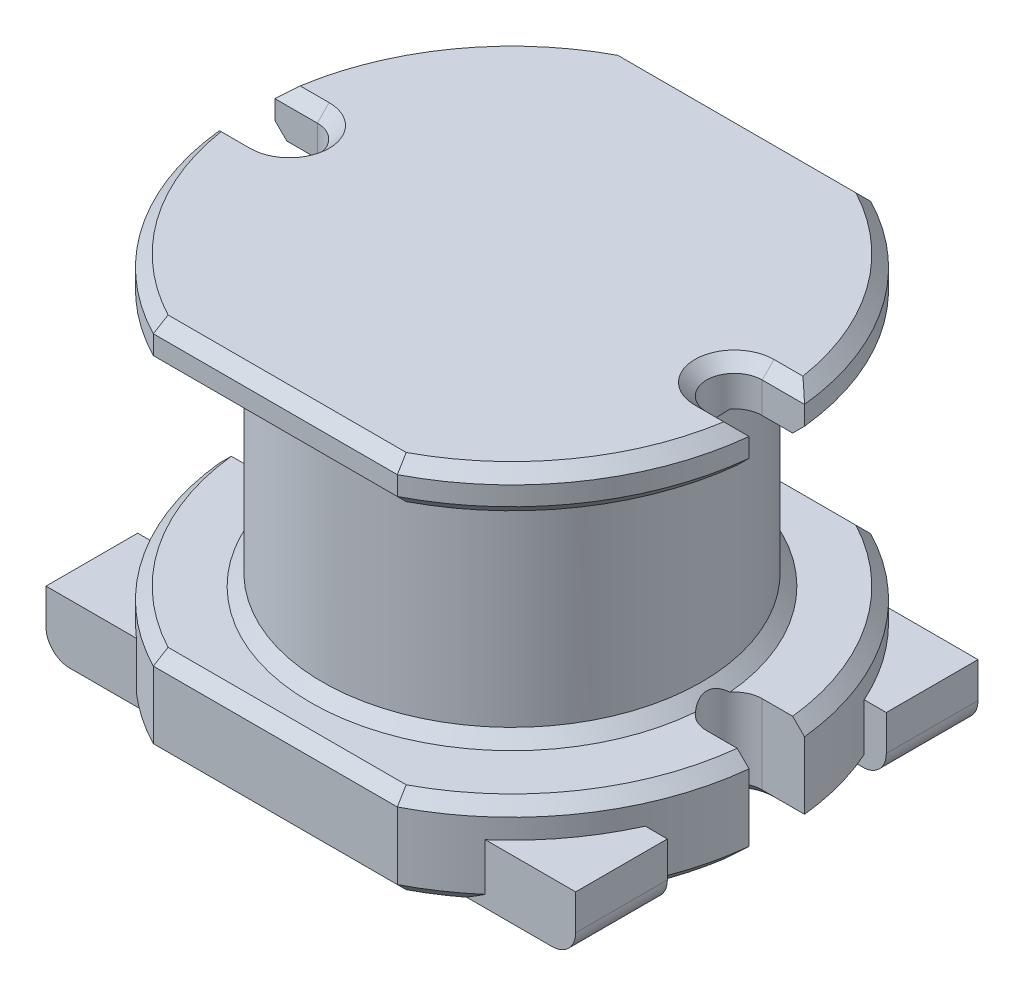
from build123d import *

# Parameters (mm, degrees)
SKETCH_2_W          = 6.934811306
SKETCH_2_H          = 5.876958734
SKETCH_2_W_2        = 4.5
SKETCH_2_H_2        = 4
CUT_EXTRUDE_1_DEPTH = 5.512759688
CUT_EXTRUDE_2_DEPTH = 5.39346105
CHAMFER_1_SIZE      = 0.1
EXTRUDE_1_DEPTH     = 0.5
FILLET_1_R          = 0.2


with BuildPart() as part:
    # Эскиз1 → Повернуть1 (revolve)
    with BuildSketch(Plane.XY, mode=Mode.PRIVATE) as revolve_1_sk:
        Polygon((0, 0), (2.25, 0), (2.25, 0.767770183), (1.602303081, 0.767770183), (1.602303081, 2.84), (2.25, 2.84), (2.25, 3.2), (0, 3.2), align=None)
    revolve(revolve_1_sk.sketch.rotate(Axis((0, 3.2, 0), (0, -1, 0)), 180), axis=Axis((0, 3.2, 0), (0, -1, 0)))

    # Эскиз2 → Вырез-Вытянуть1 (cut, through all)
    with BuildSketch(Plane(origin=(0, 3.2, 0), x_dir=(1, 0, 0), z_dir=(0, 1, 0))):
        Rectangle(SKETCH_2_W, SKETCH_2_H)
        Rectangle(SKETCH_2_W_2, SKETCH_2_H_2, mode=Mode.SUBTRACT)
    extrude(amount=-CUT_EXTRUDE_1_DEPTH, mode=Mode.SUBTRACT)

    # Эскиз3 → Вырез-Вытянуть2 (cut, through all)
    with BuildSketch(Plane(origin=(0, 3.2, 0), x_dir=(1, 0, 0), z_dir=(0, 1, 0))):
        with BuildLine():
            Line((-2.620412251, 0.234387219), (-1.879587749, 0.234387219))
            ThreePointArc((-1.879587749, 0.234387219), (-1.64520053, 0), (-1.879587749, -0.234387219))
            Line((-1.879587749, -0.234387219), (-2.620412251, -0.234387219))
            ThreePointArc((-2.620412251, -0.234387219), (-2.85479947, 0), (-2.620412251, 0.234387219))
        make_face()
        with BuildLine():
            Line((2.620412251, 0.234387219), (1.879587749, 0.234387219))
            ThreePointArc((1.879587749, 0.234387219), (1.64520053, 0), (1.879587749, -0.234387219))
            Line((1.879587749, -0.234387219), (2.620412251, -0.234387219))
            ThreePointArc((2.620412251, -0.234387219), (2.85479947, 0), (2.620412251, 0.234387219))
        make_face()
    extrude(amount=-CUT_EXTRUDE_2_DEPTH, mode=Mode.SUBTRACT)

    # Фаска1
    # the kernel refuses this chamfer: 0.1 mm, written as the material it adds along each edge
    with BuildSketch(Plane(origin=(0, 2.84, 0), x_dir=(-1, 0, 0), z_dir=(0, 0, 1))) as chamfer_1_piece_1_section:
        Polygon((1.602303081, CHAMFER_1_SIZE), (1.602303081 + CHAMFER_1_SIZE, 0), (1.602303081, 0), align=None)
    chamfer_1_piece_1 = revolve(axis=Axis((0, 2.84, 0), (0, -1, 0)), mode=Mode.PRIVATE)
    chamfer_1_piece_1 = chamfer_1_piece_1 - Plane(origin=(1.879587749, 2.757485291, 0), x_dir=(0, 0, -1), z_dir=(0, 1, 0)) * Cylinder(0.234387219, 7, mode=Mode.PRIVATE)
    chamfer_1_piece_1 = chamfer_1_piece_1 - Plane(origin=(-1.879587749, 2.757485291, 0), x_dir=(0, 0, -1), z_dir=(0, 1, 0)) * Cylinder(0.234387219, 7, mode=Mode.PRIVATE)
    add(chamfer_1_piece_1)
    with BuildSketch(Plane(origin=(0, 0.767770183, 0), x_dir=(-1, 0, 0), z_dir=(0, 0, 1))) as chamfer_1_piece_2_section:
        Polygon((1.602303081 + CHAMFER_1_SIZE, 0), (1.602303081, -CHAMFER_1_SIZE), (1.602303081, 0), align=None)
    chamfer_1_piece_2 = revolve(axis=Axis((0, 0.767770183, 0), (0, -1, 0)), mode=Mode.PRIVATE)
    chamfer_1_piece_2 = chamfer_1_piece_2 - Plane(origin=(1.879587749, 0.779846989, 0), x_dir=(0, 0, -1), z_dir=(0, 1, 0)) * Cylinder(0.234387219, 7, mode=Mode.PRIVATE)
    chamfer_1_piece_2 = chamfer_1_piece_2 - Plane(origin=(-1.879587749, 0.779846989, 0), x_dir=(0, 0, -1), z_dir=(0, 1, 0)) * Cylinder(0.234387219, 7, mode=Mode.PRIVATE)
    add(chamfer_1_piece_2)
    # the kernel refuses this chamfer: 0.1 mm, written as the material it takes off along each edge
    with BuildSketch(Plane(origin=(1.879587749, 3.2, 0), x_dir=(0, 0, -1), z_dir=(1, 0, 0))) as chamfer_1_2_piece_1:
        Polygon((0.234387219, -CHAMFER_1_SIZE), (0.234387219 + CHAMFER_1_SIZE, 0), (0.234387219, 0), align=None)
    revolve(axis=Axis((1.879587749, 3.2, 0), (0, 1, 0)), revolution_arc=180, mode=Mode.SUBTRACT)
    with BuildSketch(Plane(origin=(1.879587749, 3.2, 0.234387219), x_dir=(0, -0.9996219169112968, -0.027495876610586226), z_dir=(1, 0, 0)), Plane(origin=(1.879587749, 0, 0.234387219), x_dir=(0, -0.027495876610586088, 0.9996219169112966), z_dir=(1, 0, 0)), Plane(origin=(2.494926693, 0, -0.234387219), x_dir=(0, -0.02749587661058639, -0.9996219169112968), z_dir=(-1, 0, 0)), Plane(origin=(2.494926693, 3.2, -0.234387219), x_dir=(0, -0.9996219169112968, 0.027495876610586226), z_dir=(-1, 0, 0))) as chamfer_1_2_piece_2:
        Polygon((CHAMFER_1_SIZE * 0.999621916911, -CHAMFER_1_SIZE * 0.0274958766106), (-CHAMFER_1_SIZE * 0.0274958766106, -CHAMFER_1_SIZE * 0.999621916911), (0, 0), align=None)
    extrude(amount=0.615338944, mode=Mode.SUBTRACT)
    with BuildSketch(Plane(origin=(1.879587749, 0, 0), x_dir=(0, 0, -1), z_dir=(1, 0, 0))) as chamfer_1_2_piece_3:
        Polygon((0.234387219 + CHAMFER_1_SIZE, 0), (0.234387219, CHAMFER_1_SIZE), (0.234387219, 0), align=None)
    revolve(axis=Axis((1.879587749, 0, 0), (0, 1, 0)), revolution_arc=180, mode=Mode.SUBTRACT)
    with BuildSketch(Plane(origin=(0, 3.2, 0), x_dir=(0.9999504609043639, 0, -0.009953679578444508), z_dir=(-0.009953679578444508, 0, -0.9999504609043639))) as chamfer_1_2_piece_4:
        Polygon((2.25, CHAMFER_1_SIZE), (2.25 - CHAMFER_1_SIZE, 0), (2.25, 0), align=None)
    revolve(axis=Axis((0, 3.2, 0), (0, -1, 0)), revolution_arc=69.854051699, mode=Mode.SUBTRACT)
    with BuildSketch(Plane(origin=(1.287944705, 3.2, -2), x_dir=(0, -0.9996219169112966, -0.027495876610587302), z_dir=(-1, 0, 0)), Plane(origin=(-1.287944705, 3.2, 2), x_dir=(0, -0.9996219169112966, 0.027495876610587302), z_dir=(1, 0, 0)), Plane(origin=(1.287944705, 0, -2), x_dir=(0, -0.027495876610586313, 0.9996219169112966), z_dir=(-1, 0, 0)), Plane(origin=(-1.287944705, 0, 2), x_dir=(0, -0.027495876610586324, -0.9996219169112966), z_dir=(1, 0, 0)), Plane(origin=(-1.287944705, 2.84, 2), x_dir=(0, -0.027495876610587302, -0.9996219169112966), z_dir=(1, 0, 0)), Plane(origin=(1.287944705, 2.84, -2), x_dir=(0, -0.027495876610587302, 0.9996219169112966), z_dir=(-1, 0, 0))) as chamfer_1_2_piece_5:
        Polygon((CHAMFER_1_SIZE * 0.999621916911, CHAMFER_1_SIZE * 0.0274958766106), (-CHAMFER_1_SIZE * 0.0274958766106, CHAMFER_1_SIZE * 0.999621916911), (0, 0), align=None)
    extrude(amount=2.57588941, mode=Mode.SUBTRACT)
    with BuildSketch(Plane(origin=(0, 2.84, 0), x_dir=(0.9999504609043639, 0, -0.00995367957844411), z_dir=(-0.00995367957844411, 0, -0.9999504609043639))) as chamfer_1_2_piece_6:
        Polygon((2.25 - CHAMFER_1_SIZE, 0), (2.25, -CHAMFER_1_SIZE), (2.25, 0), align=None)
    revolve(axis=Axis((0, 2.84, 0), (0, -1, 0)), revolution_arc=69.854051699, mode=Mode.SUBTRACT)
    with BuildSketch(Plane(origin=(0, 0.767770183, 0), x_dir=(0.9999504609043639, 0, -0.009953679578444063), z_dir=(-0.009953679578444063, 0, -0.9999504609043639))) as chamfer_1_2_piece_7:
        Polygon((2.25, CHAMFER_1_SIZE), (2.25 - CHAMFER_1_SIZE, 0), (2.25, 0), align=None)
    revolve(axis=Axis((0, 0.767770183, 0), (0, -1, 0)), revolution_arc=69.854051699, mode=Mode.SUBTRACT)
    with BuildSketch(Plane(origin=(0, 0, 0), x_dir=(0.9999504609043639, 0, -0.009953679578444063), z_dir=(-0.009953679578444063, 0, -0.9999504609043639))) as chamfer_1_2_piece_8:
        Polygon((2.25 - CHAMFER_1_SIZE, 0), (2.25, -CHAMFER_1_SIZE), (2.25, 0), align=None)
    revolve(axis=Axis((0, 0, 0), (0, -1, 0)), revolution_arc=69.854051699, mode=Mode.SUBTRACT)
    with BuildSketch(Plane(origin=(1.287944705, 0.767770183, 2), x_dir=(0, -0.9996219169112966, 0.02749587661058733), z_dir=(-1, 0, 0)), Plane(origin=(-1.287944705, 0.767770183, -2), x_dir=(0, -0.9996219169112966, -0.02749587661058733), z_dir=(1, 0, 0))) as chamfer_1_2_piece_9:
        Polygon((CHAMFER_1_SIZE * 0.999621916911, -CHAMFER_1_SIZE * 0.0274958766106), (-CHAMFER_1_SIZE * 0.0274958766106, -CHAMFER_1_SIZE * 0.999621916911), (0, 0), align=None)
    extrude(amount=2.57588941, mode=Mode.SUBTRACT)
    with BuildSketch(Plane(origin=(0, 3.2, 0), x_dir=(-0.9999504609043639, 0, 0.009953679578444261), z_dir=(0.009953679578444261, 0, 0.9999504609043639))) as chamfer_1_2_piece_10:
        Polygon((2.25, CHAMFER_1_SIZE), (2.25 - CHAMFER_1_SIZE, 0), (2.25, 0), align=None)
    revolve(axis=Axis((0, 3.2, 0), (0, -1, 0)), revolution_arc=69.854051699, mode=Mode.SUBTRACT)
    with BuildSketch(Plane(origin=(0, 2.84, 0), x_dir=(-0.9999504609043639, 0, 0.009953679578444063), z_dir=(0.009953679578444063, 0, 0.9999504609043639))) as chamfer_1_2_piece_11:
        Polygon((2.25 - CHAMFER_1_SIZE, 0), (2.25, -CHAMFER_1_SIZE), (2.25, 0), align=None)
    revolve(axis=Axis((0, 2.84, 0), (0, -1, 0)), revolution_arc=69.854051699, mode=Mode.SUBTRACT)
    with BuildSketch(Plane(origin=(0, 3.2, 0), x_dir=(0.3537403249974644, 0, -0.9353436707813274), z_dir=(-0.9353436707813274, 0, -0.3537403249974644))) as chamfer_1_2_piece_12:
        Polygon((2.25, CHAMFER_1_SIZE), (2.25 - CHAMFER_1_SIZE, 0), (2.25, 0), align=None)
    revolve(axis=Axis((0, 3.2, 0), (0, -1, 0)), revolution_arc=69.854051699, mode=Mode.SUBTRACT)
    with BuildSketch(Plane(origin=(0, 3.2, 0), x_dir=(-0.35374032499740626, 0, 0.9353436707813495), z_dir=(0.9353436707813495, 0, 0.35374032499740626))) as chamfer_1_2_piece_13:
        Polygon((2.25, CHAMFER_1_SIZE), (2.25 - CHAMFER_1_SIZE, 0), (2.25, 0), align=None)
    revolve(axis=Axis((0, 3.2, 0), (0, -1, 0)), revolution_arc=69.854051699, mode=Mode.SUBTRACT)
    with BuildSketch(Plane(origin=(-1.879587749, 3.2, 0.234387219), x_dir=(0, -0.9996219169112968, -0.027495876610586226), z_dir=(-1, 0, 0)), Plane(origin=(-2.494926693, 3.2, -0.234387219), x_dir=(0, -0.9996219169112968, 0.027495876610586226), z_dir=(1, 0, 0)), Plane(origin=(-2.494926693, 0, -0.234387219), x_dir=(0, -0.027495876610586407, -0.9996219169112968), z_dir=(1, 0, 0)), Plane(origin=(-1.879587749, 0, 0.234387219), x_dir=(0, -0.027495876610586653, 0.9996219169112966), z_dir=(-1, 0, 0))) as chamfer_1_2_piece_14:
        Polygon((CHAMFER_1_SIZE * 0.999621916911, CHAMFER_1_SIZE * 0.0274958766106), (-CHAMFER_1_SIZE * 0.0274958766106, CHAMFER_1_SIZE * 0.999621916911), (0, 0), align=None)
    extrude(amount=0.615338944, mode=Mode.SUBTRACT)
    with BuildSketch(Plane(origin=(0, 2.84, 0), x_dir=(-0.35374032499745983, 0, 0.9353436707813292), z_dir=(0.9353436707813292, 0, 0.35374032499745983))) as chamfer_1_2_piece_15:
        Polygon((2.25 - CHAMFER_1_SIZE, 0), (2.25, -CHAMFER_1_SIZE), (2.25, 0), align=None)
    revolve(axis=Axis((0, 2.84, 0), (0, -1, 0)), revolution_arc=69.854051699, mode=Mode.SUBTRACT)
    with BuildSketch(Plane(origin=(0, 2.84, 0), x_dir=(0.3537403249974599, 0, -0.9353436707813292), z_dir=(-0.9353436707813292, 0, -0.3537403249974599))) as chamfer_1_2_piece_16:
        Polygon((2.25 - CHAMFER_1_SIZE, 0), (2.25, -CHAMFER_1_SIZE), (2.25, 0), align=None)
    revolve(axis=Axis((0, 2.84, 0), (0, -1, 0)), revolution_arc=69.854051699, mode=Mode.SUBTRACT)
    with BuildSketch(Plane(origin=(0, 0.767770183, 0), x_dir=(0.3537403249974597, 0, -0.9353436707813292), z_dir=(-0.9353436707813292, 0, -0.3537403249974597))) as chamfer_1_2_piece_17:
        Polygon((2.25, CHAMFER_1_SIZE), (2.25 - CHAMFER_1_SIZE, 0), (2.25, 0), align=None)
    revolve(axis=Axis((0, 0.767770183, 0), (0, -1, 0)), revolution_arc=69.854051699, mode=Mode.SUBTRACT)
    with BuildSketch(Plane(origin=(0, 0.767770183, 0), x_dir=(-0.35374032499746, 0, 0.9353436707813292), z_dir=(0.9353436707813292, 0, 0.35374032499746))) as chamfer_1_2_piece_18:
        Polygon((2.25, CHAMFER_1_SIZE), (2.25 - CHAMFER_1_SIZE, 0), (2.25, 0), align=None)
    revolve(axis=Axis((0, 0.767770183, 0), (0, -1, 0)), revolution_arc=69.854051699, mode=Mode.SUBTRACT)
    with BuildSketch(Plane(origin=(0, 0.767770183, 0), x_dir=(-0.9999504609043639, 0, 0.009953679578443817), z_dir=(0.009953679578443817, 0, 0.9999504609043639))) as chamfer_1_2_piece_19:
        Polygon((2.25, CHAMFER_1_SIZE), (2.25 - CHAMFER_1_SIZE, 0), (2.25, 0), align=None)
    revolve(axis=Axis((0, 0.767770183, 0), (0, -1, 0)), revolution_arc=69.854051699, mode=Mode.SUBTRACT)
    with BuildSketch(Plane(origin=(0, 0, 0), x_dir=(-0.35374032499745994, 0, 0.9353436707813292), z_dir=(0.9353436707813292, 0, 0.35374032499745994))) as chamfer_1_2_piece_20:
        Polygon((2.25 - CHAMFER_1_SIZE, 0), (2.25, -CHAMFER_1_SIZE), (2.25, 0), align=None)
    revolve(axis=Axis((0, 0, 0), (0, -1, 0)), revolution_arc=69.854051699, mode=Mode.SUBTRACT)
    with BuildSketch(Plane(origin=(0, 0, 0), x_dir=(0.3537403249974597, 0, -0.9353436707813292), z_dir=(-0.9353436707813292, 0, -0.3537403249974597))) as chamfer_1_2_piece_21:
        Polygon((2.25 - CHAMFER_1_SIZE, 0), (2.25, -CHAMFER_1_SIZE), (2.25, 0), align=None)
    revolve(axis=Axis((0, 0, 0), (0, -1, 0)), revolution_arc=69.854051699, mode=Mode.SUBTRACT)
    with BuildSketch(Plane(origin=(0, 0, 0), x_dir=(-0.9999504609043639, 0, 0.009953679578443817), z_dir=(0.009953679578443817, 0, 0.9999504609043639))) as chamfer_1_2_piece_22:
        Polygon((2.25 - CHAMFER_1_SIZE, 0), (2.25, -CHAMFER_1_SIZE), (2.25, 0), align=None)
    revolve(axis=Axis((0, 0, 0), (0, -1, 0)), revolution_arc=69.854051699, mode=Mode.SUBTRACT)
    with BuildSketch(Plane(origin=(-1.879587749, 3.2, 0), x_dir=(0, 0, -1), z_dir=(-1, 0, 0))) as chamfer_1_2_piece_23:
        Polygon((0.234387219, CHAMFER_1_SIZE), (0.234387219 + CHAMFER_1_SIZE, 0), (0.234387219, 0), align=None)
    revolve(axis=Axis((-1.879587749, 3.2, 0), (0, -1, 0)), revolution_arc=180, mode=Mode.SUBTRACT)
    with BuildSketch(Plane(origin=(-1.879587749, 0, 0), x_dir=(0, 0, 1), z_dir=(-1, 0, 0))) as chamfer_1_2_piece_24:
        Polygon((0.234387219 + CHAMFER_1_SIZE, 0), (0.234387219, CHAMFER_1_SIZE), (0.234387219, 0), align=None)
    revolve(axis=Axis((-1.879587749, 0, 0), (0, 1, 0)), revolution_arc=180, mode=Mode.SUBTRACT)

    # Эскиз4 → Бобышка-Вытянуть1 (add)
    with BuildSketch(Plane.XZ):
        with BuildLine():
            Line((-2.237758394, 1.7), (-2.237758394, 0.925076838))
            Line((-2.237758394, 0.925076838), (-1.940807266, 0.925076838))
            ThreePointArc((-1.940807266, 0.925076838), (-1.673984255, 1.349176309), (-1.316244658, 1.7))
            Line((-1.316244658, 1.7), (-2.237758394, 1.7))
        make_face()
        with BuildLine():
            Line((1.940807266, 0.925076838), (2.237758394, 0.925076838))
            Line((2.237758394, 0.925076838), (2.237758394, 1.7))
            Line((2.237758394, 1.7), (1.316244658, 1.7))
            ThreePointArc((1.316244658, 1.7), (1.673984255, 1.349176309), (1.940807266, 0.925076838))
        make_face()
        with BuildLine():
            Line((1.316244658, -1.7), (2.237758394, -1.7))
            Line((2.237758394, -1.7), (2.237758394, -0.925076838))
            Line((2.237758394, -0.925076838), (1.940807266, -0.925076838))
            ThreePointArc((1.940807266, -0.925076838), (1.673984255, -1.349176309), (1.316244658, -1.7))
        make_face()
        with BuildLine():
            Line((-2.237758394, -0.925076838), (-2.237758394, -1.7))
            Line((-2.237758394, -1.7), (-1.316244658, -1.7))
            ThreePointArc((-1.316244658, -1.7), (-1.673984255, -1.349176309), (-1.940807266, -0.925076838))
            Line((-1.940807266, -0.925076838), (-2.237758394, -0.925076838))
        make_face()
    extrude(amount=-EXTRUDE_1_DEPTH)

    # Скругление1
    fillet_1_edges = [part.edges().sort_by_distance(p)[0] for p in [
        (-2.237758394, 0, 1.312538419),
        (2.237758394, 0, 1.312538419),
        (2.237758394, 0, -1.312538419),
        (-2.237758394, 0, -1.312538419),
    ]]
    fillet(fillet_1_edges, radius=FILLET_1_R)


solid = part.part
